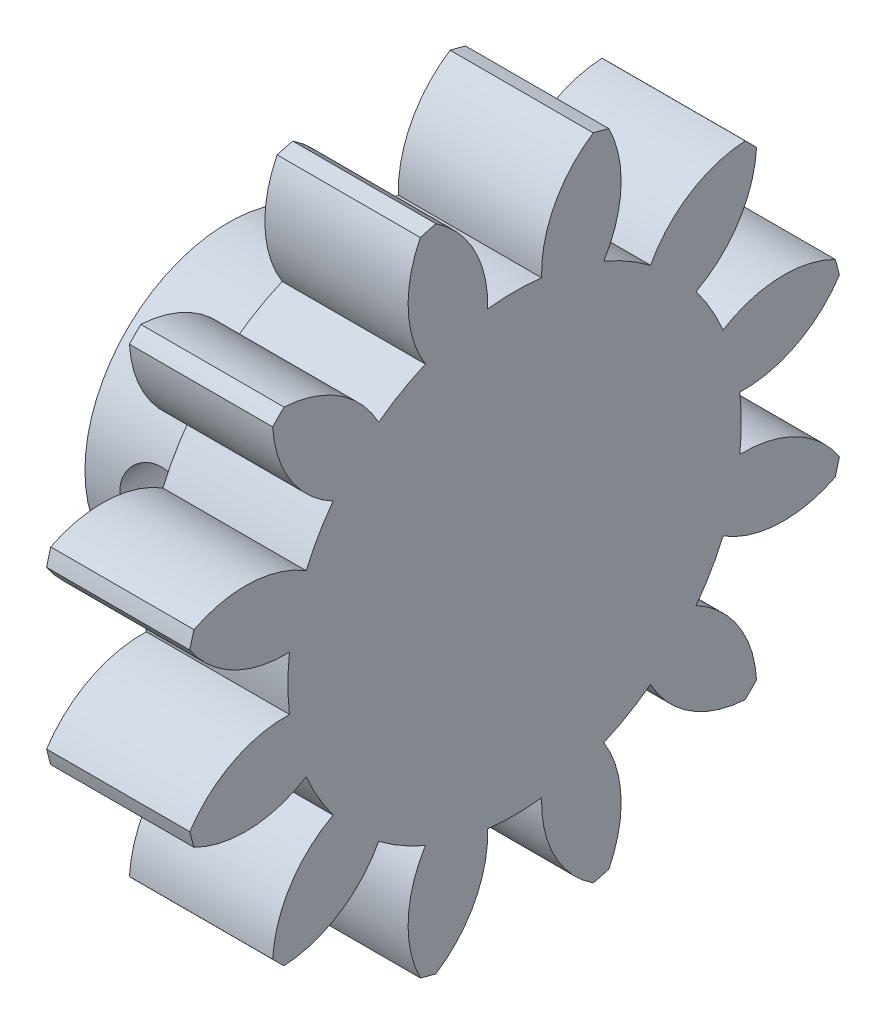
from build123d import *

# Parameters (mm, degrees)
BASPROSKE_W             = 12.7
BASPROSKE_H             = 29.633333333
TOOTHCUT_DEPTH          = 44.789940499
TEETHCUTS_COUNT         = 12
TEETHCUTS_ANGLE         = 330
SKETCH1_R               = 12.7
SKETCH1_R_2             = 5.715
BOSS_EXTRUDE1_DEPTH     = 12.7
CUT_EXTRUDE1_REACH      = 55.104
CUT_EXTRUDE1_END_RADIUS = 5.715
SKETCH2_R               = 3.2512
CUT_EXTRUDE2_DEPTH      = 7.62


with BuildPart() as part:
    # BasProSke → Base-Revolve (revolve)
    with BuildSketch(Plane(origin=(0, 0, 0), x_dir=(1, 0, 0), z_dir=(0, 1, 0))):
        with Locations((6.35, 14.816666667)):
            Rectangle(BASPROSKE_W, BASPROSKE_H)
    revolve(axis=Axis((-10, 0, 0), (1, 0, 0)))

    # TooCutSke → ToothCut (cut, through all)
    with BuildSketch(Plane(origin=(0, 0, 0), x_dir=(0, 0, -1), z_dir=(1, 0, 0))):
        with BuildLine():
            ThreePointArc((2.3928109, 19.964179219), (0, 20.107063333), (-2.3928109, 19.964179219))
            ThreePointArc((-2.3928109, 19.964179219), (-3.536123556, 24.99754811), (-7.005125344, 28.819588509))
            ThreePointArc((-7.005125344, 28.819588509), (0, 29.658733333), (7.005125344, 28.819588509))
            ThreePointArc((7.005125344, 28.819588509), (3.536123556, 24.99754811), (2.3928109, 19.964179219))
        make_face()
    toothcut = extrude(amount=TOOTHCUT_DEPTH, mode=Mode.SUBTRACT)

    # TeethCuts: ToothCut ×12 about axis
    teethcuts_axis = Axis((-10, 0, 0), (1, 0, 0))
    for i in range(1, TEETHCUTS_COUNT):
        add(toothcut.rotate(teethcuts_axis, i * TEETHCUTS_ANGLE / (TEETHCUTS_COUNT - 1)), mode=Mode.SUBTRACT)

    # Sketch1 → Boss-Extrude1 (add)
    with BuildSketch(Plane.ZY):
        Circle(SKETCH1_R)
        Circle(SKETCH1_R_2, mode=Mode.SUBTRACT)
    extrude(amount=BOSS_EXTRUDE1_DEPTH)

    # Cut-Extrude1: up to this cylinder (the profile starts outside it)
    cut_extrude1_end = Plane(origin=(-6.35, 0, 0), z_dir=(1, 0, 0)) * Cylinder(CUT_EXTRUDE1_END_RADIUS, 122.638, mode=Mode.PRIVATE)
    # Sketch2 → Cut-Extrude1 (cut, up to the surface)
    with BuildSketch(Plane.XY.offset(13.97), mode=Mode.PRIVATE) as cut_extrude1_sk1:
        with Locations((-6.35, 0)):
            Circle(SKETCH2_R)
    cut_extrude1_tool1 = extrude(cut_extrude1_sk1.sketch, amount=-CUT_EXTRUDE1_REACH, mode=Mode.PRIVATE) - cut_extrude1_end
    add(cut_extrude1_tool1.solids().sort_by_distance((-6.35, 0, 13.97))[0], mode=Mode.SUBTRACT)

    # Sketch4 → Cut-Extrude2 (cut)
    with BuildSketch(Plane.XY):
        Polygon((-1.524, 2.786292399), (-6.35, 5.572584798), (-11.176, 2.786292399), (-11.176, -2.786292399), (-6.35, -5.572584798), (-1.524, -2.786292399), align=None)
    extrude(amount=CUT_EXTRUDE2_DEPTH, mode=Mode.SUBTRACT)


solid = part.part
